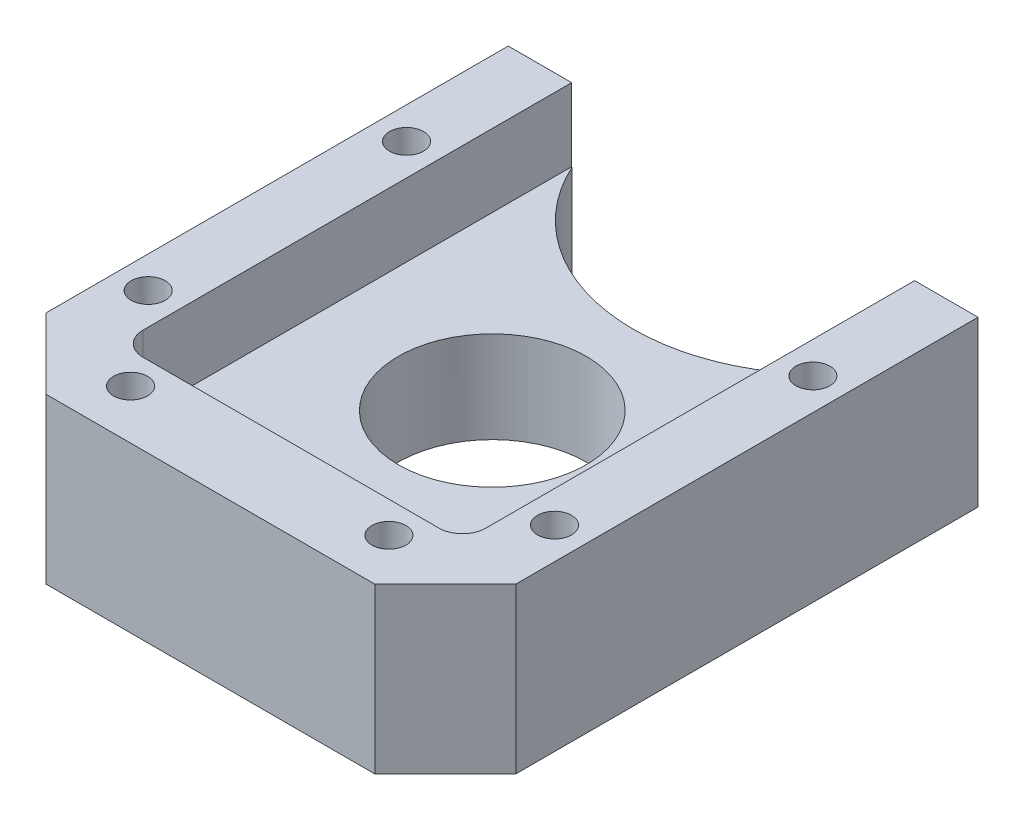
from build123d import *

# Parameters (mm, degrees)
SKETCH1_W                      = 40
SKETCH1_H                      = 45.36
BOSS_EXTRUDE1_DEPTH            = 14
SKETCH2_W                      = 29.2
SKETCH2_H                      = 38.5
CUT_EXTRUDE1_DEPTH             = 6.2
M2_5_CLEARANCE_HOLE1_OUTLINE_R = 1.45
M2_5_CLEARANCE_HOLE1_DEPTH     = 14
F_16_0MM_DOWEL_HOLE1_D         = 16
SKETCH11_R                     = 16
CUT_EXTRUDE2_DEPTH             = 63.076804041
CHAMFER1_SIZE                  = 6
FILLET1_R                      = 2


# Read off the part's stored shape, not the designer's step: M2.5 Clearance Hole1
with BuildPart() as part:
    # Sketch1 → Boss-Extrude1 (new body)
    with BuildSketch(Plane(origin=(0, 0, 0), x_dir=(1, 0, 0), z_dir=(0, 1, 0))):
        with Locations((20, 22.68)):
            Rectangle(SKETCH1_W, SKETCH1_H)
    extrude(amount=BOSS_EXTRUDE1_DEPTH)

    # Sketch2 → Cut-Extrude1 (cut)
    with BuildSketch(Plane(origin=(0, 14, 0), x_dir=(1, 0, 0), z_dir=(0, 1, 0))):
        with Locations((20, 26.11)):
            Rectangle(SKETCH2_W, SKETCH2_H)
    extrude(amount=-CUT_EXTRUDE1_DEPTH, mode=Mode.SUBTRACT)

    # M2.5 Clearance Hole1 outline → M2.5 Clearance Hole1 (cut)
    with BuildSketch(Plane(origin=(0, 0, 0), x_dir=(1, 0, 0), z_dir=(0, 1, 0))):
        with Locations((9, 4.2)):
            Circle(M2_5_CLEARANCE_HOLE1_OUTLINE_R)
        with Locations((31, 4.2)):
            Circle(M2_5_CLEARANCE_HOLE1_OUTLINE_R)
        with Locations((2.7, 34)):
            Circle(M2_5_CLEARANCE_HOLE1_OUTLINE_R)
        with Locations((2.7, 12)):
            Circle(M2_5_CLEARANCE_HOLE1_OUTLINE_R)
        with Locations((37.3, 12)):
            Circle(M2_5_CLEARANCE_HOLE1_OUTLINE_R)
        with Locations((37.3, 34)):
            Circle(M2_5_CLEARANCE_HOLE1_OUTLINE_R)
    extrude(amount=M2_5_CLEARANCE_HOLE1_DEPTH, mode=Mode.SUBTRACT)

    # Ø16.0mm Dowel Hole1 (through all)
    with Locations(Plane(origin=(0, 0, 0), x_dir=(-1, 0, 0), z_dir=(0, -1, 0))):
        with Locations((-20, 24)):
            Hole(F_16_0MM_DOWEL_HOLE1_D / 2)

    # Sketch11 → Cut-Extrude2 (cut, through all)
    with BuildSketch(Plane.XZ):
        with Locations((20, -52)):
            Circle(SKETCH11_R)
    extrude(amount=-CUT_EXTRUDE2_DEPTH, mode=Mode.SUBTRACT)

    # Chamfer1
    chamfer1_edges = [part.edges().sort_by_distance(p)[0] for p in [
        (0, 7, 0),
        (40, 7, 0),
    ]]
    chamfer(chamfer1_edges, length=CHAMFER1_SIZE)

    # Fillet1
    fillet1_edges = [part.edges().sort_by_distance(p)[0] for p in [
        (5.4, 10.9, -6.86),
        (34.6, 10.9, -6.86),
    ]]
    fillet(fillet1_edges, radius=FILLET1_R)


solid = part.part
